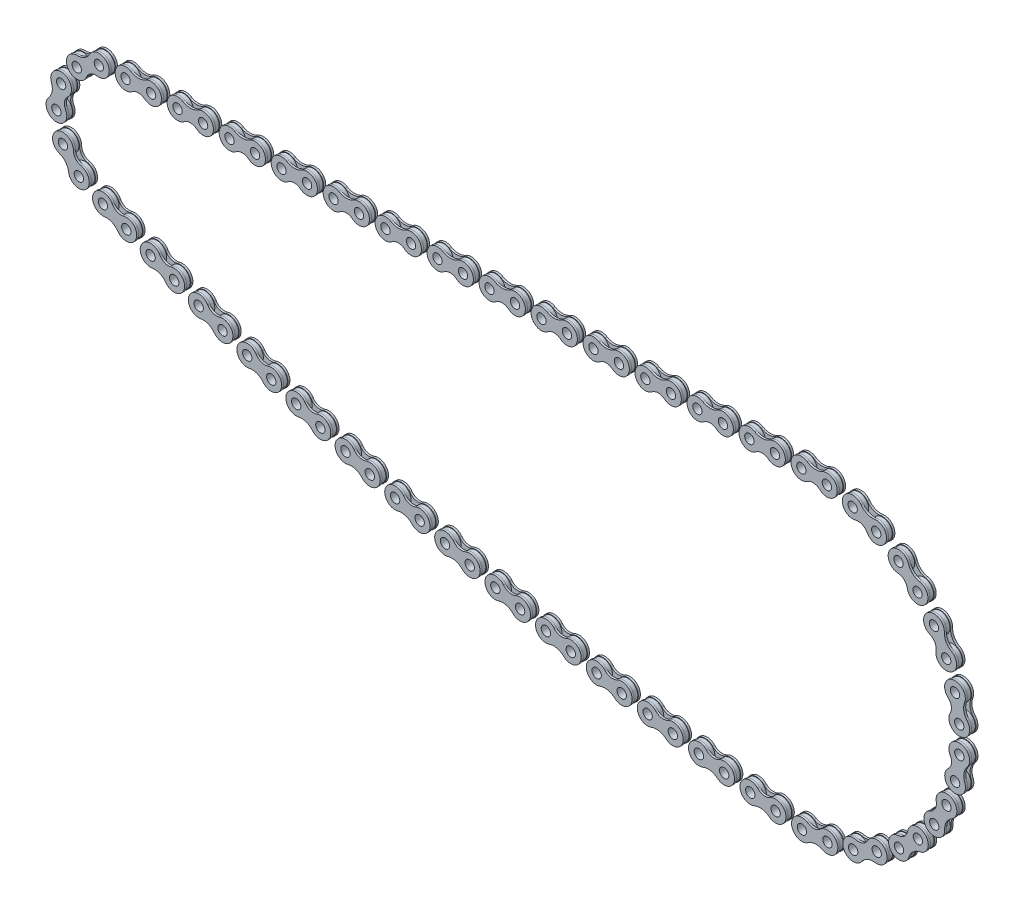
from build123d import *

# Parameters (mm, degrees)
SZKIC1_R                      = 4.75
SZKIC1_R_2                    = 2.25
DODANIE_WYCI_GNI_CIE1_DEPTH   = 2
DODANIE_WYCI_GNI_CIE1_2_DEPTH = 2
SZKIC2_R                      = 2.25
DODANIE_WYCI_GNI_CIE2_DEPTH   = 1
CRVPATTERN1_5_ANGLE           = 3.8901012
CRVPATTERN1_6_ANGLE           = 23.0027709
CRVPATTERN1_7_ANGLE           = 42.1154406
CRVPATTERN1_8_ANGLE           = 61.2281103
CRVPATTERN1_9_ANGLE           = 80.34078
CRVPATTERN1_10_ANGLE          = 99.4534497
CRVPATTERN1_11_ANGLE          = 118.5661194
CRVPATTERN1_12_ANGLE          = 137.6787891
CRVPATTERN1_13_ANGLE          = 156.7914588
CRVPATTERN1_14_ANGLE          = 175.9041285
CRVPATTERN1_15_ANGLE          = 172.3357403
CRVPATTERN1_16_ANGLE          = 171.095109
CRVPATTERN1_17_ANGLE          = 169.8544777
CRVPATTERN1_18_ANGLE          = 168.6138464
CRVPATTERN1_19_ANGLE          = 167.3732151
CRVPATTERN1_20_ANGLE          = 166.1325838
CRVPATTERN1_21_ANGLE          = 164.8919525
CRVPATTERN1_22_ANGLE          = 163.6513212
CRVPATTERN1_23_ANGLE          = 162.4106898
CRVPATTERN1_24_ANGLE          = 161.1700585
CRVPATTERN1_25_ANGLE          = 159.9294272
CRVPATTERN1_26_ANGLE          = 158.6887959
CRVPATTERN1_27_ANGLE          = 157.4481646
CRVPATTERN1_28_ANGLE          = 156.2075333
CRVPATTERN1_29_ANGLE          = 128.6116148
CRVPATTERN1_30_ANGLE          = 79.3521569
CRVPATTERN1_31_ANGLE          = 30.0926989


with BuildPart() as part:
    # Szkic1 → Dodanie-wyciągnięcie1 (new body)
    with BuildSketch(Plane.XY):
        with Locations((-6.15, 0)):
            Circle(SZKIC1_R)
        with Locations((-6.15, 0)):
            Circle(SZKIC1_R_2, mode=Mode.SUBTRACT)
    extrude(amount=DODANIE_WYCI_GNI_CIE1_DEPTH)



with BuildPart() as body_2:
    # Szkic1 → Dodanie-wyci_gni_cie1 2 (new body)
    with BuildSketch(Plane.XY):
        with Locations(Location((6.15, 0, 0), (0, 0, 180))):
            Circle(SZKIC1_R)
        with Locations((6.15, 0)):
            Circle(SZKIC1_R_2, mode=Mode.SUBTRACT)
    extrude(amount=DODANIE_WYCI_GNI_CIE1_2_DEPTH)


with BuildPart() as part_1:
    add(part.part)

    add(body_2.part)  # Dodanie-wyciągnięcie2 merges body 2
    # Szkic2 → Dodanie-wyciągnięcie2 (add)
    with BuildSketch(Plane.XY.offset(2)):
        with BuildLine():
            ThreePointArc((-3.546716527, 4.268830655), (-11.140120021, -0.314169031), (-3.031878781, -3.908621248))
            ThreePointArc((-3.031878781, -3.908621248), (0, -2.847428355), (3.031878781, -3.908621248))
            ThreePointArc((3.031878781, -3.908621248), (11.140120021, -0.314169031), (3.546716527, 4.268830655))
            ThreePointArc((3.546716527, 4.268830655), (0, 3.272684661), (-3.546716527, 4.268830655))
        make_face()
        with Locations((6.15, 0)):
            Circle(SZKIC2_R, mode=Mode.SUBTRACT)
        with Locations((-6.15, 0)):
            Circle(SZKIC2_R, mode=Mode.SUBTRACT)
    dodanie_wyci_gni_cie2 = extrude(amount=DODANIE_WYCI_GNI_CIE2_DEPTH)

    # Lustro1: Dodanie-wyciągnięcie2 across plane
    add(dodanie_wyci_gni_cie2.mirror(Plane.XY.offset(1)))


with BuildPart() as body_2_2:
    # CrvPattern1: read off the stored shape, not the designer's step
    # CrvPattern1: copy of part
    add(part_1.part.moved(Location((25.0184261, 0, 0))))


with BuildPart() as body_3:
    # CrvPattern1 2: copy of part
    add(part_1.part.moved(Location((50.0368522, 0, 0))))


with BuildPart() as body_4:
    # CrvPattern1 3: copy of part
    add(part_1.part.moved(Location((75.0552784, 0, 0))))


with BuildPart() as body_5:
    # CrvPattern1 4: copy of part
    add(part_1.part.moved(Location((100.0737045, 0, 0))))


with BuildPart() as body_6:
    # CrvPattern1 5: copy of part
    add(part_1.part.moved(Location((124.8091249, 8.3138609, 0))).rotate(Axis((0, 0, 0), (0, 0, -1)), CRVPATTERN1_5_ANGLE))


with BuildPart() as body_7:
    # CrvPattern1 6: copy of part
    add(part_1.part.moved(Location((139.7514191, 52.8535646, 0))).rotate(Axis((0, 0, 0), (0, 0, -1)), CRVPATTERN1_6_ANGLE))


with BuildPart() as body_8:
    # CrvPattern1 7: copy of part
    add(part_1.part.moved(Location((139.2865476, 99.8305935, 0))).rotate(Axis((0, 0, 0), (0, 0, -1)), CRVPATTERN1_7_ANGLE))


with BuildPart() as body_9:
    # CrvPattern1 8: copy of part
    add(part_1.part.moved(Location((123.4657609, 144.0658743, 0))).rotate(Axis((0, 0, 0), (0, 0, -1)), CRVPATTERN1_8_ANGLE))


with BuildPart() as body_10:
    # CrvPattern1 9: copy of part
    add(part_1.part.moved(Location((94.0332525, 180.6826028, 0))).rotate(Axis((0, 0, 0), (0, 0, -1)), CRVPATTERN1_9_ANGLE))


with BuildPart() as body_11:
    # CrvPattern1 10: copy of part
    add(part_1.part.moved(Location((54.2338661, 205.6438968, 0))).rotate(Axis((0, 0, 0), (0, 0, -1)), CRVPATTERN1_10_ANGLE))


with BuildPart() as body_12:
    # CrvPattern1 11: copy of part
    add(part_1.part.moved(Location((8.4553621, 216.1978502, 0))).rotate(Axis((0, 0, 0), (0, 0, -1)), CRVPATTERN1_11_ANGLE))


with BuildPart() as body_13:
    # CrvPattern1 12: copy of part
    add(part_1.part.moved(Location((-38.2553196, 211.1809219, 0))).rotate(Axis((0, 0, 0), (0, 0, -1)), CRVPATTERN1_12_ANGLE))


with BuildPart() as body_14:
    # CrvPattern1 13: copy of part
    add(part_1.part.moved(Location((-80.7484696, 191.1462129, 0))).rotate(Axis((0, 0, 0), (0, 0, -1)), CRVPATTERN1_13_ANGLE))


with BuildPart() as body_15:
    # CrvPattern1 14: copy of part
    add(part_1.part.moved(Location((-114.3393482, 158.3024886, 0))).rotate(Axis((0, 0, 0), (0, 0, -1)), CRVPATTERN1_14_ANGLE))


with BuildPart() as body_16:
    # CrvPattern1 15: copy of part
    add(part_1.part.moved(Location((-119.3011241, 133.2919224, 0))).rotate(Axis((0, 0, 0), (0, 0, 1)), CRVPATTERN1_15_ANGLE))


with BuildPart() as body_17:
    # CrvPattern1 16: copy of part
    add(part_1.part.moved(Location((-97.1434794, 130.9484824, 0))).rotate(Axis((0, 0, 0), (0, 0, 1)), CRVPATTERN1_16_ANGLE))


with BuildPart() as body_18:
    # CrvPattern1 17: copy of part
    add(part_1.part.moved(Location((-74.94029, 129.085336, 0))).rotate(Axis((0, 0, 0), (0, 0, 1)), CRVPATTERN1_17_ANGLE))


with BuildPart() as body_19:
    # CrvPattern1 18: copy of part
    add(part_1.part.moved(Location((-52.7019657, 127.7033566, 0))).rotate(Axis((0, 0, 0), (0, 0, 1)), CRVPATTERN1_18_ANGLE))


with BuildPart() as body_20:
    # CrvPattern1 19: copy of part
    add(part_1.part.moved(Location((-30.4389327, 126.8031923, 0))).rotate(Axis((0, 0, 0), (0, 0, 1)), CRVPATTERN1_19_ANGLE))


with BuildPart() as body_21:
    # CrvPattern1 20: copy of part
    add(part_1.part.moved(Location((-8.1616288, 126.385265, 0))).rotate(Axis((0, 0, 0), (0, 0, 1)), CRVPATTERN1_20_ANGLE))


with BuildPart() as body_22:
    # CrvPattern1 21: copy of part
    add(part_1.part.moved(Location((14.1195016, 126.4497708, 0))).rotate(Axis((0, 0, 0), (0, 0, 1)), CRVPATTERN1_21_ANGLE))


with BuildPart() as body_23:
    # CrvPattern1 22: copy of part
    add(part_1.part.moved(Location((36.3940122, 126.9966793, 0))).rotate(Axis((0, 0, 0), (0, 0, 1)), CRVPATTERN1_22_ANGLE))


with BuildPart() as body_24:
    # CrvPattern1 23: copy of part
    add(part_1.part.moved(Location((58.6514599, 128.0257341, 0))).rotate(Axis((0, 0, 0), (0, 0, 1)), CRVPATTERN1_23_ANGLE))


with BuildPart() as body_25:
    # CrvPattern1 24: copy of part
    add(part_1.part.moved(Location((80.8814096, 129.5364528, 0))).rotate(Axis((0, 0, 0), (0, 0, 1)), CRVPATTERN1_24_ANGLE))


with BuildPart() as body_26:
    # CrvPattern1 25: copy of part
    add(part_1.part.moved(Location((103.0734389, 131.5281271, 0))).rotate(Axis((0, 0, 0), (0, 0, 1)), CRVPATTERN1_25_ANGLE))


with BuildPart() as body_27:
    # CrvPattern1 26: copy of part
    add(part_1.part.moved(Location((125.2171435, 133.9998232, 0))).rotate(Axis((0, 0, 0), (0, 0, 1)), CRVPATTERN1_26_ANGLE))


with BuildPart() as body_28:
    # CrvPattern1 27: copy of part
    add(part_1.part.moved(Location((147.3021414, 136.9503823, 0))).rotate(Axis((0, 0, 0), (0, 0, 1)), CRVPATTERN1_27_ANGLE))


with BuildPart() as body_29:
    # CrvPattern1 28: copy of part
    add(part_1.part.moved(Location((169.3180785, 140.378421, 0))).rotate(Axis((0, 0, 0), (0, 0, 1)), CRVPATTERN1_28_ANGLE))


with BuildPart() as body_30:
    # CrvPattern1 29: copy of part
    add(part_1.part.moved(Location((108.2659316, 211.197436, 0))).rotate(Axis((0, 0, 0), (0, 0, 1)), CRVPATTERN1_29_ANGLE))


with BuildPart() as body_31:
    # CrvPattern1 30: copy of part
    add(part_1.part.moved(Location((-67.3413754, 229.9598523, 0))).rotate(Axis((0, 0, 0), (0, 0, 1)), CRVPATTERN1_30_ANGLE))


with BuildPart() as body_32:
    # CrvPattern1 31: copy of part
    add(part_1.part.moved(Location((-196.1645669, 109.1519889, 0))).rotate(Axis((0, 0, 0), (0, 0, 1)), CRVPATTERN1_31_ANGLE))


with BuildPart() as body_33:
    # CrvPattern1 32: copy of part
    add(part_1.part.moved(Location((-200.147409, 0, 0))))


with BuildPart() as body_34:
    # CrvPattern1 33: copy of part
    add(part_1.part.moved(Location((-175.1289829, 0, 0))))


with BuildPart() as body_35:
    # CrvPattern1 34: copy of part
    add(part_1.part.moved(Location((-150.1105567, 0, 0))))


with BuildPart() as body_36:
    # CrvPattern1 35: copy of part
    add(part_1.part.moved(Location((-125.0921306, 0, 0))))


with BuildPart() as body_37:
    # CrvPattern1 36: copy of part
    add(part_1.part.moved(Location((-100.0737045, 0, 0))))


with BuildPart() as body_38:
    # CrvPattern1 37: copy of part
    add(part_1.part.moved(Location((-75.0552784, 0, 0))))


with BuildPart() as body_39:
    # CrvPattern1 38: copy of part
    add(part_1.part.moved(Location((-50.0368522, 0, 0))))


with BuildPart() as body_40:
    # CrvPattern1 39: copy of part
    add(part_1.part.moved(Location((-25.0184261, 0, 0))))


solid = Compound([part_1.part, body_2_2.part, body_3.part, body_4.part, body_5.part, body_6.part, body_7.part, body_8.part, body_9.part, body_10.part, body_11.part, body_12.part, body_13.part, body_14.part, body_15.part, body_16.part, body_17.part, body_18.part, body_19.part, body_20.part, body_21.part, body_22.part, body_23.part, body_24.part, body_25.part, body_26.part, body_27.part, body_28.part, body_29.part, body_30.part, body_31.part, body_32.part, body_33.part, body_34.part, body_35.part, body_36.part, body_37.part, body_38.part, body_39.part, body_40.part])
